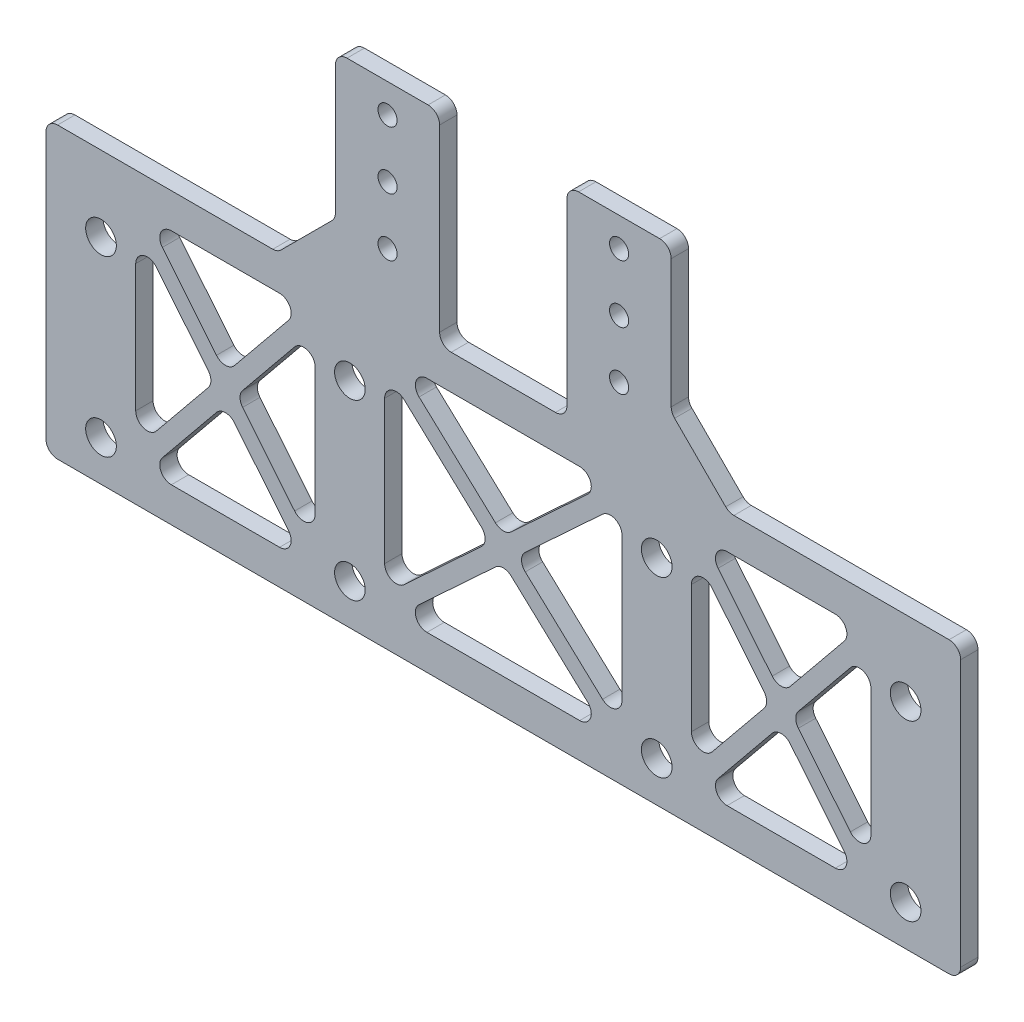
from build123d import *

# Parameters (mm, degrees)
SKETCH_1_R          = 1.55
SKETCH_1_R_2        = 2.65
SKETCH_1_W          = 31
SKETCH_1_H          = 38
SKETCH_1_W_2        = 41
EXTRUDE_1_DEPTH     = 3
SKETCH_4_W          = 20
SKETCH_4_H          = 35
CUT_EXTRUDE_1_DEPTH = 10
SKETCH_3_W          = 18
SKETCH_3_H          = 35
EXTRUDE_2_DEPTH     = 3
SKETCH_5_R          = 1.65
CUT_EXTRUDE_2_DEPTH = 5
CHAMFER_1_SIZE      = 10
FILLET_1_R          = 2
EXTRUDE_1_2_DEPTH   = 3
FILLET_3_R          = 2


with BuildPart() as part:
    # 草图1 → Extrude 1 (new body)
    with BuildSketch(Plane.XY):
        Polygon((-10, 50), (-10, 85), (10, 85), (10, 50), (79, 50), (79, 0), (-79, 0), (-79, 50), align=None)
        with Locations((-6, 81)):
            Circle(SKETCH_1_R, mode=Mode.SUBTRACT)
        with Locations((6, 81)):
            Circle(SKETCH_1_R, mode=Mode.SUBTRACT)
        with Locations((-6, 59)):
            Circle(SKETCH_1_R, mode=Mode.SUBTRACT)
        with Locations((6, 59)):
            Circle(SKETCH_1_R, mode=Mode.SUBTRACT)
        with Locations((-69.5, 37)):
            Circle(SKETCH_1_R_2, mode=Mode.SUBTRACT)
        with Locations((-69.5, 7)):
            Circle(SKETCH_1_R_2, mode=Mode.SUBTRACT)
        with Locations((69.5, 7)):
            Circle(SKETCH_1_R_2, mode=Mode.SUBTRACT)
        with Locations((69.5, 37)):
            Circle(SKETCH_1_R_2, mode=Mode.SUBTRACT)
        with Locations((-26.5, 37)):
            Circle(SKETCH_1_R_2, mode=Mode.SUBTRACT)
        with Locations((-26.5, 7)):
            Circle(SKETCH_1_R_2, mode=Mode.SUBTRACT)
        with Locations((26.5, 7)):
            Circle(SKETCH_1_R_2, mode=Mode.SUBTRACT)
        with Locations((26.5, 37)):
            Circle(SKETCH_1_R_2, mode=Mode.SUBTRACT)
        with Locations((-48, 25)):
            Rectangle(SKETCH_1_W, SKETCH_1_H, mode=Mode.SUBTRACT)
        with Locations((48, 25)):
            Rectangle(SKETCH_1_W, SKETCH_1_H, mode=Mode.SUBTRACT)
        with Locations((0, 25)):
            Rectangle(SKETCH_1_W_2, SKETCH_1_H, mode=Mode.SUBTRACT)
    extrude(amount=EXTRUDE_1_DEPTH)

    # 草图4 → 切除-拉伸1 (cut)
    with BuildSketch(Plane(origin=(0, 0, 0), x_dir=(-1, 0, 0), z_dir=(0, 0, -1))):
        with Locations((0, 67.5)):
            Rectangle(SKETCH_4_W, SKETCH_4_H)
    extrude(amount=-CUT_EXTRUDE_1_DEPTH, mode=Mode.SUBTRACT)

    # 草图3 → 凸台-拉伸2 (add)
    with BuildSketch(Plane(origin=(0, 0, 0), x_dir=(-1, 0, 0), z_dir=(0, 0, -1))):
        with Locations((-20, 67.5)):
            Rectangle(SKETCH_3_W, SKETCH_3_H)
        with Locations((20, 67.5)):
            Rectangle(SKETCH_3_W, SKETCH_3_H)
    extrude(amount=-EXTRUDE_2_DEPTH)

    # 草图5 → 切除-拉伸2 (cut)
    with BuildSketch(Plane(origin=(0, 0, 0), x_dir=(-1, 0, 0), z_dir=(0, 0, -1))):
        with Locations((-20, 80)):
            Circle(SKETCH_5_R)
        with Locations((-20, 70)):
            Circle(SKETCH_5_R)
        with Locations((-20, 60)):
            Circle(SKETCH_5_R)
        with Locations((20, 60)):
            Circle(SKETCH_5_R)
        with Locations((20, 70)):
            Circle(SKETCH_5_R)
        with Locations((20, 80)):
            Circle(SKETCH_5_R)
    extrude(amount=-CUT_EXTRUDE_2_DEPTH, mode=Mode.SUBTRACT)

    # 倒角1
    chamfer_1_edges = [part.edges().sort_by_distance(p)[0] for p in [
        (-29, 50, 1.5),
        (29, 50, 1.5),
    ]]
    chamfer(chamfer_1_edges, length=CHAMFER_1_SIZE)

    # 圆角1
    fillet_1_edges = [part.edges().sort_by_distance(p)[0] for p in [
        (79, 0, 1.5),
        (-79, 0, 1.5),
        (-79, 50, 1.5),
        (-39, 50, 1.5),
        (-29, 60, 1.5),
        (-29, 85, 1.5),
        (-11, 85, 1.5),
        (-11, 50, 1.5),
        (11, 50, 1.5),
        (11, 85, 1.5),
        (29, 85, 1.5),
        (39, 50, 1.5),
        (79, 50, 1.5),
        (29, 60, 1.5),
    ]]
    fillet(fillet_1_edges, radius=FILLET_1_R)

    # 草图6 → Extrude 1 2 (add)
    with BuildSketch(Plane(origin=(0, 0, 0), x_dir=(-1, 0, 0), z_dir=(0, 0, -1))):
        Polygon((-64.662297531, 43.051809909), (-33.662297531, 5.051809909), (-31.337702469, 6.948190091), (-62.337702469, 44.948190091), align=None)
        Polygon((-33.662297531, 44.948190091), (-64.662297531, 6.948190091), (-62.337702469, 5.051809909), (-31.337702469, 43.051809909), align=None)
        Polygon((-21.519646998, 42.899854555), (19.480353002, 4.899854555), (21.519646998, 7.100145445), (-19.480353002, 45.100145445), align=None)
        Polygon((19.480353002, 45.100145445), (-21.519646998, 7.100145445), (-19.480353002, 4.899854555), (21.519646998, 42.899854555), align=None)
        Polygon((31.337702469, 43.051809909), (62.337702469, 5.051809909), (64.662297531, 6.948190091), (33.662297531, 44.948190091), align=None)
        Polygon((62.337702469, 44.948190091), (31.337702469, 6.948190091), (33.662297531, 5.051809909), (64.662297531, 43.051809909), align=None)
    extrude(amount=-EXTRUDE_1_2_DEPTH)

    # 圆角3
    fillet_3_edges = [part.edges().sort_by_distance(p)[0] for p in [
        (0, 22.954815874, 1.5),
        (18.29335397, 6, 1.5),
        (-18.29335397, 6, 1.5),
        (-20.5, 41.954815874, 1.5),
        (-2.20664603, 25, 1.5),
        (-20.5, 8.045184126, 1.5),
        (20.5, 8.045184126, 1.5),
        (2.20664603, 25, 1.5),
        (20.5, 41.954815874, 1.5),
        (0, 27.045184126, 1.5),
        (-18.29335397, 44, 1.5),
        (18.29335397, 44, 1.5),
        (48, 27.372941904, 1.5),
        (34.435821027, 44, 1.5),
        (61.564178973, 44, 1.5),
        (63.5, 8.372941904, 1.5),
        (49.935821027, 25, 1.5),
        (32.5, 41.627058096, 1.5),
        (46.064178973, 25, 1.5),
        (32.5, 8.372941904, 1.5),
        (48, 22.627058096, 1.5),
        (61.564178973, 6, 1.5),
        (34.435821027, 6, 1.5),
        (-48, 27.372941904, 1.5),
        (-61.564178973, 44, 1.5),
        (-34.435821027, 44, 1.5),
        (-32.5, 8.372941904, 1.5),
        (-46.064178973, 25, 1.5),
        (-32.5, 41.627058096, 1.5),
        (-63.5, 41.627058096, 1.5),
        (-49.935821027, 25, 1.5),
        (-63.5, 8.372941904, 1.5),
        (-48, 22.627058096, 1.5),
        (-34.435821027, 6, 1.5),
        (-61.564178973, 6, 1.5),
        (63.5, 41.627058096, 1.5),
    ]]
    fillet(fillet_3_edges, radius=FILLET_3_R)


solid = part.part
